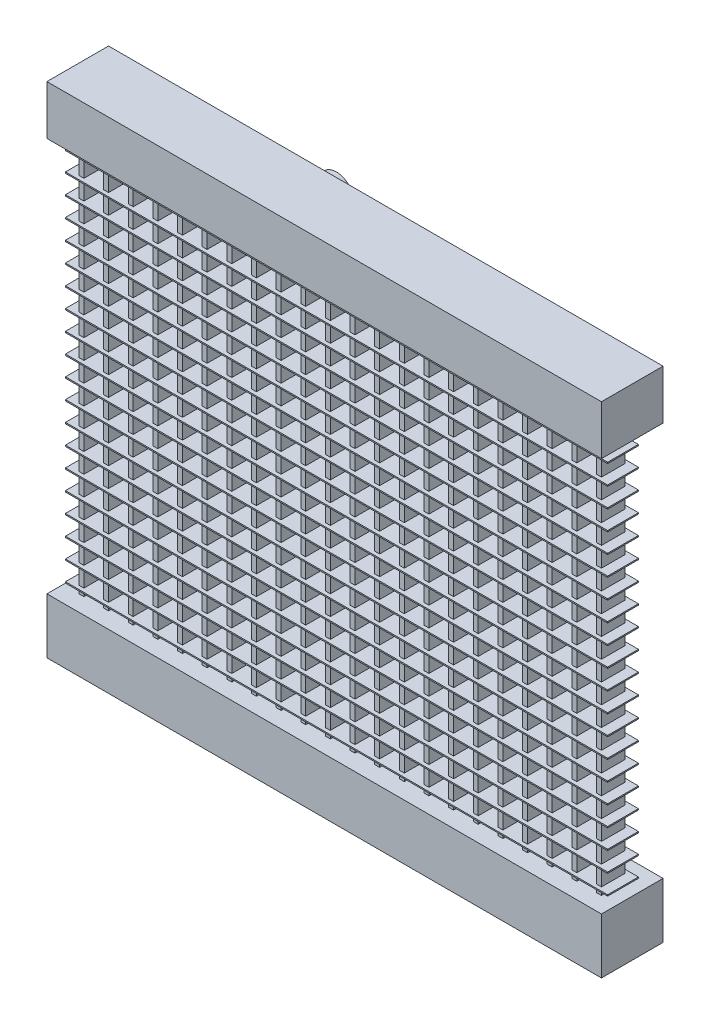
from build123d import *

# Parameters (mm, degrees)
LIQUID_HEADER_ENVELOPE_NO_INTERNAL_CIRCU_START = 285
SKETCH1_W                                      = 450
SKETCH1_H                                      = 45
LIQUID_HEADER_ENVELOPE_NO_INTERNAL_CIRCU_DEPTH = 50
VAPOUR_HEADER_ENVELOPE_NO_INTERNAL_CIRCU_START = 285
SKETCH2_W                                      = 450
SKETCH2_H                                      = 40
VAPOUR_HEADER_ENVELOPE_NO_INTERNAL_CIRCU_DEPTH = 50
REFRIGERANT_TUBE_VISUAL_ENVELOPE_START         = 303
SKETCH3_W                                      = 4
SKETCH3_H                                      = 320
REFRIGERANT_TUBE_VISUAL_ENVELOPE_DEPTH         = 19
BOSS_EXTRUDE4_START                            = 303
SKETCH4_W                                      = 4
SKETCH4_H                                      = 320
BOSS_EXTRUDE4_DEPTH                            = 19
BOSS_EXTRUDE5_START                            = 303
SKETCH5_W                                      = 4
SKETCH5_H                                      = 320
BOSS_EXTRUDE5_DEPTH                            = 19
BOSS_EXTRUDE6_START                            = 303
SKETCH6_W                                      = 4
SKETCH6_H                                      = 320
BOSS_EXTRUDE6_DEPTH                            = 19
BOSS_EXTRUDE7_START                            = 303
SKETCH7_W                                      = 4
SKETCH7_H                                      = 320
BOSS_EXTRUDE7_DEPTH                            = 19
BOSS_EXTRUDE8_START                            = 303
SKETCH8_W                                      = 4
SKETCH8_H                                      = 320
BOSS_EXTRUDE8_DEPTH                            = 19
BOSS_EXTRUDE9_START                            = 303
SKETCH9_W                                      = 4
SKETCH9_H                                      = 320
BOSS_EXTRUDE9_DEPTH                            = 19
BOSS_EXTRUDE10_START                           = 303
SKETCH10_W                                     = 4
SKETCH10_H                                     = 320
BOSS_EXTRUDE10_DEPTH                           = 19
BOSS_EXTRUDE11_START                           = 303
SKETCH11_W                                     = 4
SKETCH11_H                                     = 320
BOSS_EXTRUDE11_DEPTH                           = 19
BOSS_EXTRUDE12_START                           = 303
SKETCH12_W                                     = 4
SKETCH12_H                                     = 320
BOSS_EXTRUDE12_DEPTH                           = 19
BOSS_EXTRUDE13_START                           = 303
SKETCH13_W                                     = 4
SKETCH13_H                                     = 320
BOSS_EXTRUDE13_DEPTH                           = 19
BOSS_EXTRUDE14_START                           = 303
SKETCH14_W                                     = 4
SKETCH14_H                                     = 320
BOSS_EXTRUDE14_DEPTH                           = 19
BOSS_EXTRUDE15_START                           = 303
SKETCH15_W                                     = 4
SKETCH15_H                                     = 320
BOSS_EXTRUDE15_DEPTH                           = 19
BOSS_EXTRUDE16_START                           = 303
SKETCH16_W                                     = 4
SKETCH16_H                                     = 320
BOSS_EXTRUDE16_DEPTH                           = 19
BOSS_EXTRUDE17_START                           = 303
SKETCH17_W                                     = 4
SKETCH17_H                                     = 320
BOSS_EXTRUDE17_DEPTH                           = 19
BOSS_EXTRUDE18_START                           = 303
SKETCH18_W                                     = 4
SKETCH18_H                                     = 320
BOSS_EXTRUDE18_DEPTH                           = 19
BOSS_EXTRUDE19_START                           = 303
SKETCH19_W                                     = 4
SKETCH19_H                                     = 320
BOSS_EXTRUDE19_DEPTH                           = 19
BOSS_EXTRUDE20_START                           = 303
SKETCH20_W                                     = 4
SKETCH20_H                                     = 320
BOSS_EXTRUDE20_DEPTH                           = 19
BOSS_EXTRUDE21_START                           = 303
SKETCH21_W                                     = 4
SKETCH21_H                                     = 320
BOSS_EXTRUDE21_DEPTH                           = 19
BOSS_EXTRUDE22_START                           = 303
SKETCH22_W                                     = 4
SKETCH22_H                                     = 320
BOSS_EXTRUDE22_DEPTH                           = 19
BOSS_EXTRUDE23_START                           = 303
SKETCH23_W                                     = 4
SKETCH23_H                                     = 320
BOSS_EXTRUDE23_DEPTH                           = 19
BOSS_EXTRUDE24_START                           = 303
SKETCH24_W                                     = 4
SKETCH24_H                                     = 320
BOSS_EXTRUDE24_DEPTH                           = 19
AIR_FIN_SIMPLIFIED_START                       = 300
SKETCH25_W                                     = 440
SKETCH25_H                                     = 1
AIR_FIN_SIMPLIFIED_DEPTH                       = 25
BOSS_EXTRUDE26_START                           = 300
SKETCH26_W                                     = 440
SKETCH26_H                                     = 1
BOSS_EXTRUDE26_DEPTH                           = 25
BOSS_EXTRUDE27_START                           = 300
SKETCH27_W                                     = 440
SKETCH27_H                                     = 1
BOSS_EXTRUDE27_DEPTH                           = 25
BOSS_EXTRUDE28_START                           = 300
SKETCH28_W                                     = 440
SKETCH28_H                                     = 1
BOSS_EXTRUDE28_DEPTH                           = 25
BOSS_EXTRUDE29_START                           = 300
SKETCH29_W                                     = 440
SKETCH29_H                                     = 1
BOSS_EXTRUDE29_DEPTH                           = 25
BOSS_EXTRUDE30_START                           = 300
SKETCH30_W                                     = 440
SKETCH30_H                                     = 1
BOSS_EXTRUDE30_DEPTH                           = 25
BOSS_EXTRUDE31_START                           = 300
SKETCH31_W                                     = 440
SKETCH31_H                                     = 1
BOSS_EXTRUDE31_DEPTH                           = 25
BOSS_EXTRUDE32_START                           = 300
SKETCH32_W                                     = 440
SKETCH32_H                                     = 1
BOSS_EXTRUDE32_DEPTH                           = 25
BOSS_EXTRUDE33_START                           = 300
SKETCH33_W                                     = 440
SKETCH33_H                                     = 1
BOSS_EXTRUDE33_DEPTH                           = 25
BOSS_EXTRUDE34_START                           = 300
SKETCH34_W                                     = 440
SKETCH34_H                                     = 1
BOSS_EXTRUDE34_DEPTH                           = 25
BOSS_EXTRUDE35_START                           = 300
SKETCH35_W                                     = 440
SKETCH35_H                                     = 1
BOSS_EXTRUDE35_DEPTH                           = 25
BOSS_EXTRUDE36_START                           = 300
SKETCH36_W                                     = 440
SKETCH36_H                                     = 1
BOSS_EXTRUDE36_DEPTH                           = 25
BOSS_EXTRUDE37_START                           = 300
SKETCH37_W                                     = 440
SKETCH37_H                                     = 1
BOSS_EXTRUDE37_DEPTH                           = 25
BOSS_EXTRUDE38_START                           = 300
SKETCH38_W                                     = 440
SKETCH38_H                                     = 1
BOSS_EXTRUDE38_DEPTH                           = 25
BOSS_EXTRUDE39_START                           = 300
SKETCH39_W                                     = 440
SKETCH39_H                                     = 1
BOSS_EXTRUDE39_DEPTH                           = 25
BOSS_EXTRUDE40_START                           = 300
SKETCH40_W                                     = 440
SKETCH40_H                                     = 1
BOSS_EXTRUDE40_DEPTH                           = 25
BOSS_EXTRUDE41_START                           = 300
SKETCH41_W                                     = 440
SKETCH41_H                                     = 1
BOSS_EXTRUDE41_DEPTH                           = 25
BOSS_EXTRUDE42_START                           = 300
SKETCH42_W                                     = 440
SKETCH42_H                                     = 1
BOSS_EXTRUDE42_DEPTH                           = 25
BOSS_EXTRUDE43_START                           = 300
SKETCH43_W                                     = 440
SKETCH43_H                                     = 1
BOSS_EXTRUDE43_DEPTH                           = 25
BOSS_EXTRUDE44_START                           = 300
SKETCH44_W                                     = 440
SKETCH44_H                                     = 1
BOSS_EXTRUDE44_DEPTH                           = 25
VAPOUR_INLET_ID16_POSITION_ASSUMED_START       = 270
SKETCH45_R                                     = 14
SKETCH45_R_2                                   = 8
VAPOUR_INLET_ID16_POSITION_ASSUMED_DEPTH       = 15
LIQUID_OUTLET_ID6_POSITION_ASSUMED_START       = 270
SKETCH46_R                                     = 10
SKETCH46_R_2                                   = 3
LIQUID_OUTLET_ID6_POSITION_ASSUMED_DEPTH       = 15


with BuildPart() as part:
    # Sketch1 → Liquid_header_ENVELOPE_NO_INTERNAL_CIRCUITING (new body)
    with BuildSketch(Plane.XY.offset(LIQUID_HEADER_ENVELOPE_NO_INTERNAL_CIRCU_START)):
        with Locations((0, 62.5)):
            Rectangle(SKETCH1_W, SKETCH1_H)
    extrude(amount=LIQUID_HEADER_ENVELOPE_NO_INTERNAL_CIRCU_DEPTH)


with BuildPart() as body_2:
    # Sketch2 → Vapour_header_ENVELOPE_NO_INTERNAL_CIRCUITING (new body)
    with BuildSketch(Plane.XY.offset(VAPOUR_HEADER_ENVELOPE_NO_INTERNAL_CIRCU_START)):
        with Locations((0, 425)):
            Rectangle(SKETCH2_W, SKETCH2_H)
    extrude(amount=VAPOUR_HEADER_ENVELOPE_NO_INTERNAL_CIRCU_DEPTH)


with BuildPart() as body_3:
    # Sketch3 → Refrigerant_tube_VISUAL_ENVELOPE (new body)
    with BuildSketch(Plane.XY.offset(REFRIGERANT_TUBE_VISUAL_ENVELOPE_START)):
        with Locations((-210, 245)):
            Rectangle(SKETCH3_W, SKETCH3_H)
    extrude(amount=REFRIGERANT_TUBE_VISUAL_ENVELOPE_DEPTH)


with BuildPart() as body_4:
    # Sketch4 → Boss-Extrude4 (new body)
    with BuildSketch(Plane.XY.offset(BOSS_EXTRUDE4_START)):
        with Locations((-190, 245)):
            Rectangle(SKETCH4_W, SKETCH4_H)
    extrude(amount=BOSS_EXTRUDE4_DEPTH)


with BuildPart() as body_5:
    # Sketch5 → Boss-Extrude5 (new body)
    with BuildSketch(Plane.XY.offset(BOSS_EXTRUDE5_START)):
        with Locations((-170, 245)):
            Rectangle(SKETCH5_W, SKETCH5_H)
    extrude(amount=BOSS_EXTRUDE5_DEPTH)


with BuildPart() as body_6:
    # Sketch6 → Boss-Extrude6 (new body)
    with BuildSketch(Plane.XY.offset(BOSS_EXTRUDE6_START)):
        with Locations((-150, 245)):
            Rectangle(SKETCH6_W, SKETCH6_H)
    extrude(amount=BOSS_EXTRUDE6_DEPTH)


with BuildPart() as body_7:
    # Sketch7 → Boss-Extrude7 (new body)
    with BuildSketch(Plane.XY.offset(BOSS_EXTRUDE7_START)):
        with Locations((-130, 245)):
            Rectangle(SKETCH7_W, SKETCH7_H)
    extrude(amount=BOSS_EXTRUDE7_DEPTH)


with BuildPart() as body_8:
    # Sketch8 → Boss-Extrude8 (new body)
    with BuildSketch(Plane.XY.offset(BOSS_EXTRUDE8_START)):
        with Locations((-110, 245)):
            Rectangle(SKETCH8_W, SKETCH8_H)
    extrude(amount=BOSS_EXTRUDE8_DEPTH)


with BuildPart() as body_9:
    # Sketch9 → Boss-Extrude9 (new body)
    with BuildSketch(Plane.XY.offset(BOSS_EXTRUDE9_START)):
        with Locations((-90, 245)):
            Rectangle(SKETCH9_W, SKETCH9_H)
    extrude(amount=BOSS_EXTRUDE9_DEPTH)


with BuildPart() as body_10:
    # Sketch10 → Boss-Extrude10 (new body)
    with BuildSketch(Plane.XY.offset(BOSS_EXTRUDE10_START)):
        with Locations((-70, 245)):
            Rectangle(SKETCH10_W, SKETCH10_H)
    extrude(amount=BOSS_EXTRUDE10_DEPTH)


with BuildPart() as body_11:
    # Sketch11 → Boss-Extrude11 (new body)
    with BuildSketch(Plane.XY.offset(BOSS_EXTRUDE11_START)):
        with Locations((-50, 245)):
            Rectangle(SKETCH11_W, SKETCH11_H)
    extrude(amount=BOSS_EXTRUDE11_DEPTH)


with BuildPart() as body_12:
    # Sketch12 → Boss-Extrude12 (new body)
    with BuildSketch(Plane.XY.offset(BOSS_EXTRUDE12_START)):
        with Locations((-30, 245)):
            Rectangle(SKETCH12_W, SKETCH12_H)
    extrude(amount=BOSS_EXTRUDE12_DEPTH)


with BuildPart() as body_13:
    # Sketch13 → Boss-Extrude13 (new body)
    with BuildSketch(Plane.XY.offset(BOSS_EXTRUDE13_START)):
        with Locations((-10, 245)):
            Rectangle(SKETCH13_W, SKETCH13_H)
    extrude(amount=BOSS_EXTRUDE13_DEPTH)


with BuildPart() as body_14:
    # Sketch14 → Boss-Extrude14 (new body)
    with BuildSketch(Plane.XY.offset(BOSS_EXTRUDE14_START)):
        with Locations((10, 245)):
            Rectangle(SKETCH14_W, SKETCH14_H)
    extrude(amount=BOSS_EXTRUDE14_DEPTH)


with BuildPart() as body_15:
    # Sketch15 → Boss-Extrude15 (new body)
    with BuildSketch(Plane.XY.offset(BOSS_EXTRUDE15_START)):
        with Locations((30, 245)):
            Rectangle(SKETCH15_W, SKETCH15_H)
    extrude(amount=BOSS_EXTRUDE15_DEPTH)


with BuildPart() as body_16:
    # Sketch16 → Boss-Extrude16 (new body)
    with BuildSketch(Plane.XY.offset(BOSS_EXTRUDE16_START)):
        with Locations((50, 245)):
            Rectangle(SKETCH16_W, SKETCH16_H)
    extrude(amount=BOSS_EXTRUDE16_DEPTH)


with BuildPart() as body_17:
    # Sketch17 → Boss-Extrude17 (new body)
    with BuildSketch(Plane.XY.offset(BOSS_EXTRUDE17_START)):
        with Locations((70, 245)):
            Rectangle(SKETCH17_W, SKETCH17_H)
    extrude(amount=BOSS_EXTRUDE17_DEPTH)


with BuildPart() as body_18:
    # Sketch18 → Boss-Extrude18 (new body)
    with BuildSketch(Plane.XY.offset(BOSS_EXTRUDE18_START)):
        with Locations((90, 245)):
            Rectangle(SKETCH18_W, SKETCH18_H)
    extrude(amount=BOSS_EXTRUDE18_DEPTH)


with BuildPart() as body_19:
    # Sketch19 → Boss-Extrude19 (new body)
    with BuildSketch(Plane.XY.offset(BOSS_EXTRUDE19_START)):
        with Locations((110, 245)):
            Rectangle(SKETCH19_W, SKETCH19_H)
    extrude(amount=BOSS_EXTRUDE19_DEPTH)


with BuildPart() as body_20:
    # Sketch20 → Boss-Extrude20 (new body)
    with BuildSketch(Plane.XY.offset(BOSS_EXTRUDE20_START)):
        with Locations((130, 245)):
            Rectangle(SKETCH20_W, SKETCH20_H)
    extrude(amount=BOSS_EXTRUDE20_DEPTH)


with BuildPart() as body_21:
    # Sketch21 → Boss-Extrude21 (new body)
    with BuildSketch(Plane.XY.offset(BOSS_EXTRUDE21_START)):
        with Locations((150, 245)):
            Rectangle(SKETCH21_W, SKETCH21_H)
    extrude(amount=BOSS_EXTRUDE21_DEPTH)


with BuildPart() as body_22:
    # Sketch22 → Boss-Extrude22 (new body)
    with BuildSketch(Plane.XY.offset(BOSS_EXTRUDE22_START)):
        with Locations((170, 245)):
            Rectangle(SKETCH22_W, SKETCH22_H)
    extrude(amount=BOSS_EXTRUDE22_DEPTH)


with BuildPart() as body_23:
    # Sketch23 → Boss-Extrude23 (new body)
    with BuildSketch(Plane.XY.offset(BOSS_EXTRUDE23_START)):
        with Locations((190, 245)):
            Rectangle(SKETCH23_W, SKETCH23_H)
    extrude(amount=BOSS_EXTRUDE23_DEPTH)


with BuildPart() as body_24:
    # Sketch24 → Boss-Extrude24 (new body)
    with BuildSketch(Plane.XY.offset(BOSS_EXTRUDE24_START)):
        with Locations((210, 245)):
            Rectangle(SKETCH24_W, SKETCH24_H)
    extrude(amount=BOSS_EXTRUDE24_DEPTH)


with BuildPart() as body_25:
    # Sketch25 → Air_fin_SIMPLIFIED (new body)
    with BuildSketch(Plane.XY.offset(AIR_FIN_SIMPLIFIED_START)):
        with Locations((0, 90.5)):
            Rectangle(SKETCH25_W, SKETCH25_H)
    extrude(amount=AIR_FIN_SIMPLIFIED_DEPTH)


with BuildPart() as body_26:
    # Sketch26 → Boss-Extrude26 (new body)
    with BuildSketch(Plane.XY.offset(BOSS_EXTRUDE26_START)):
        with Locations((0, 106.5)):
            Rectangle(SKETCH26_W, SKETCH26_H)
    extrude(amount=BOSS_EXTRUDE26_DEPTH)


with BuildPart() as body_27:
    # Sketch27 → Boss-Extrude27 (new body)
    with BuildSketch(Plane.XY.offset(BOSS_EXTRUDE27_START)):
        with Locations((0, 122.5)):
            Rectangle(SKETCH27_W, SKETCH27_H)
    extrude(amount=BOSS_EXTRUDE27_DEPTH)


with BuildPart() as body_28:
    # Sketch28 → Boss-Extrude28 (new body)
    with BuildSketch(Plane.XY.offset(BOSS_EXTRUDE28_START)):
        with Locations((0, 138.5)):
            Rectangle(SKETCH28_W, SKETCH28_H)
    extrude(amount=BOSS_EXTRUDE28_DEPTH)


with BuildPart() as body_29:
    # Sketch29 → Boss-Extrude29 (new body)
    with BuildSketch(Plane.XY.offset(BOSS_EXTRUDE29_START)):
        with Locations((0, 154.5)):
            Rectangle(SKETCH29_W, SKETCH29_H)
    extrude(amount=BOSS_EXTRUDE29_DEPTH)


with BuildPart() as body_30:
    # Sketch30 → Boss-Extrude30 (new body)
    with BuildSketch(Plane.XY.offset(BOSS_EXTRUDE30_START)):
        with Locations((0, 170.5)):
            Rectangle(SKETCH30_W, SKETCH30_H)
    extrude(amount=BOSS_EXTRUDE30_DEPTH)


with BuildPart() as body_31:
    # Sketch31 → Boss-Extrude31 (new body)
    with BuildSketch(Plane.XY.offset(BOSS_EXTRUDE31_START)):
        with Locations((0, 186.5)):
            Rectangle(SKETCH31_W, SKETCH31_H)
    extrude(amount=BOSS_EXTRUDE31_DEPTH)


with BuildPart() as body_32:
    # Sketch32 → Boss-Extrude32 (new body)
    with BuildSketch(Plane.XY.offset(BOSS_EXTRUDE32_START)):
        with Locations((0, 202.5)):
            Rectangle(SKETCH32_W, SKETCH32_H)
    extrude(amount=BOSS_EXTRUDE32_DEPTH)


with BuildPart() as body_33:
    # Sketch33 → Boss-Extrude33 (new body)
    with BuildSketch(Plane.XY.offset(BOSS_EXTRUDE33_START)):
        with Locations((0, 218.5)):
            Rectangle(SKETCH33_W, SKETCH33_H)
    extrude(amount=BOSS_EXTRUDE33_DEPTH)


with BuildPart() as body_34:
    # Sketch34 → Boss-Extrude34 (new body)
    with BuildSketch(Plane.XY.offset(BOSS_EXTRUDE34_START)):
        with Locations((0, 234.5)):
            Rectangle(SKETCH34_W, SKETCH34_H)
    extrude(amount=BOSS_EXTRUDE34_DEPTH)


with BuildPart() as body_35:
    # Sketch35 → Boss-Extrude35 (new body)
    with BuildSketch(Plane.XY.offset(BOSS_EXTRUDE35_START)):
        with Locations((0, 250.5)):
            Rectangle(SKETCH35_W, SKETCH35_H)
    extrude(amount=BOSS_EXTRUDE35_DEPTH)


with BuildPart() as body_36:
    # Sketch36 → Boss-Extrude36 (new body)
    with BuildSketch(Plane.XY.offset(BOSS_EXTRUDE36_START)):
        with Locations((0, 266.5)):
            Rectangle(SKETCH36_W, SKETCH36_H)
    extrude(amount=BOSS_EXTRUDE36_DEPTH)


with BuildPart() as body_37:
    # Sketch37 → Boss-Extrude37 (new body)
    with BuildSketch(Plane.XY.offset(BOSS_EXTRUDE37_START)):
        with Locations((0, 282.5)):
            Rectangle(SKETCH37_W, SKETCH37_H)
    extrude(amount=BOSS_EXTRUDE37_DEPTH)


with BuildPart() as body_38:
    # Sketch38 → Boss-Extrude38 (new body)
    with BuildSketch(Plane.XY.offset(BOSS_EXTRUDE38_START)):
        with Locations((0, 298.5)):
            Rectangle(SKETCH38_W, SKETCH38_H)
    extrude(amount=BOSS_EXTRUDE38_DEPTH)


with BuildPart() as body_39:
    # Sketch39 → Boss-Extrude39 (new body)
    with BuildSketch(Plane.XY.offset(BOSS_EXTRUDE39_START)):
        with Locations((0, 314.5)):
            Rectangle(SKETCH39_W, SKETCH39_H)
    extrude(amount=BOSS_EXTRUDE39_DEPTH)


with BuildPart() as body_40:
    # Sketch40 → Boss-Extrude40 (new body)
    with BuildSketch(Plane.XY.offset(BOSS_EXTRUDE40_START)):
        with Locations((0, 330.5)):
            Rectangle(SKETCH40_W, SKETCH40_H)
    extrude(amount=BOSS_EXTRUDE40_DEPTH)


with BuildPart() as body_41:
    # Sketch41 → Boss-Extrude41 (new body)
    with BuildSketch(Plane.XY.offset(BOSS_EXTRUDE41_START)):
        with Locations((0, 346.5)):
            Rectangle(SKETCH41_W, SKETCH41_H)
    extrude(amount=BOSS_EXTRUDE41_DEPTH)


with BuildPart() as body_42:
    # Sketch42 → Boss-Extrude42 (new body)
    with BuildSketch(Plane.XY.offset(BOSS_EXTRUDE42_START)):
        with Locations((0, 362.5)):
            Rectangle(SKETCH42_W, SKETCH42_H)
    extrude(amount=BOSS_EXTRUDE42_DEPTH)


with BuildPart() as body_43:
    # Sketch43 → Boss-Extrude43 (new body)
    with BuildSketch(Plane.XY.offset(BOSS_EXTRUDE43_START)):
        with Locations((0, 378.5)):
            Rectangle(SKETCH43_W, SKETCH43_H)
    extrude(amount=BOSS_EXTRUDE43_DEPTH)


with BuildPart() as body_44:
    # Sketch44 → Boss-Extrude44 (new body)
    with BuildSketch(Plane.XY.offset(BOSS_EXTRUDE44_START)):
        with Locations((0, 394.5)):
            Rectangle(SKETCH44_W, SKETCH44_H)
    extrude(amount=BOSS_EXTRUDE44_DEPTH)


with BuildPart() as body_45:
    # Sketch45 → Vapour_inlet_ID16_POSITION_ASSUMED (new body)
    with BuildSketch(Plane.XY.offset(VAPOUR_INLET_ID16_POSITION_ASSUMED_START)):
        with Locations((-55, 420)):
            Circle(SKETCH45_R)
        with Locations((-55, 420)):
            Circle(SKETCH45_R_2, mode=Mode.SUBTRACT)
    extrude(amount=VAPOUR_INLET_ID16_POSITION_ASSUMED_DEPTH)


with BuildPart() as body_46:
    # Sketch46 → Liquid_outlet_ID6_POSITION_ASSUMED (new body)
    with BuildSketch(Plane.XY.offset(LIQUID_OUTLET_ID6_POSITION_ASSUMED_START)):
        with Locations((-30, 64)):
            Circle(SKETCH46_R)
        with Locations((-30, 64)):
            Circle(SKETCH46_R_2, mode=Mode.SUBTRACT)
    extrude(amount=LIQUID_OUTLET_ID6_POSITION_ASSUMED_DEPTH)


solid = Compound([part.part, body_2.part, body_3.part, body_4.part, body_5.part, body_6.part, body_7.part, body_8.part, body_9.part, body_10.part, body_11.part, body_12.part, body_13.part, body_14.part, body_15.part, body_16.part, body_17.part, body_18.part, body_19.part, body_20.part, body_21.part, body_22.part, body_23.part, body_24.part, body_25.part, body_26.part, body_27.part, body_28.part, body_29.part, body_30.part, body_31.part, body_32.part, body_33.part, body_34.part, body_35.part, body_36.part, body_37.part, body_38.part, body_39.part, body_40.part, body_41.part, body_42.part, body_43.part, body_44.part, body_45.part, body_46.part])
